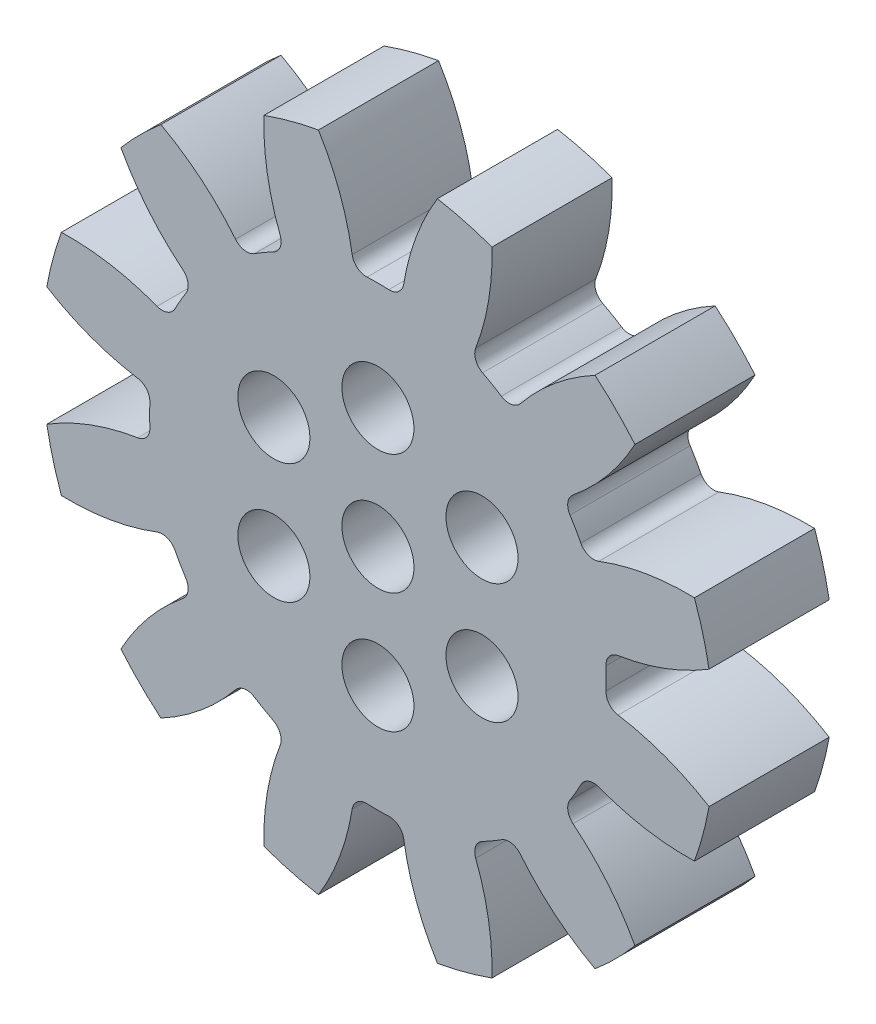
from build123d import *

# Parameters (mm, degrees)
SKETCH1_R                = 14
BOSS_EXTRUDE1_DEPTH      = 2.5
CUT_EXTRUDE1_DEPTH       = 20.956202043
FILLET1_R                = 0.6
FILLET2_R                = 0.6
CIRPATTERN2_COUNT        = 12
FILLET1_OF_CIRPATTERN2_R = 0.6
FILLET2_OF_CIRPATTERN2_R = 0.6
CUT_EXTRUDE2_DEPTH       = 21.118127499
CUT_EXTRUDE2_DEPTH_BACK  = 21.118127499
SKETCH4_R                = 1.5


with BuildPart() as part:
    # Sketch1 → Boss-Extrude1 (new, symmetric)
    with BuildSketch(Plane.XY):
        Circle(SKETCH1_R)
    extrude(amount=BOSS_EXTRUDE1_DEPTH, both=True)

    # Sketch2 → Cut-Extrude1 (cut, symmetric)
    with BuildSketch(Plane.XY):
        with BuildLine():
            ThreePointArc((-3.314591405, 14.951229823), (-1.751535203, 12.36983933), (-0.999747632, 9.447248524))
            ThreePointArc((-0.999747632, 9.447248524), (0, 9.5), (0.999747632, 9.447248524))
            ThreePointArc((0.999747632, 9.447248524), (1.751535203, 12.36983933), (3.314591405, 14.951229823))
            ThreePointArc((3.314591405, 14.951229823), (0, 15.314234862), (-3.314591405, 14.951229823))
        make_face()
    cut_extrude1 = extrude(amount=CUT_EXTRUDE1_DEPTH, both=True, mode=Mode.SUBTRACT)

    # Fillet1
    fillet1_edges = [part.edges().sort_by_distance(p)[0] for p in [
        (-0.999747632, 9.447248524, 0),
    ]]
    fillet(fillet1_edges, radius=FILLET1_R)

    # Fillet2
    fillet2_edges = [part.edges().sort_by_distance(p)[0] for p in [
        (0.999747632, 9.447248524, 0),
    ]]
    fillet(fillet2_edges, radius=FILLET2_R)

    # CirPattern2: Cut-Extrude1 ×12 about axis
    cirpattern2_axis = Axis((0, 0, 2.5), (0, 0, 1))
    for i in range(1, CIRPATTERN2_COUNT):
        add(cut_extrude1.rotate(cirpattern2_axis, i * 360 / CIRPATTERN2_COUNT), mode=Mode.SUBTRACT)

    # Fillet1 of CirPattern2
    fillet1_of_cirpattern2_edges = [part.edges().sort_by_distance(p)[0] for p in [
        (-5.589431109, 7.681683401, 0),
        (-8.681431034, 3.857817415, 0),
        (-9.447248524, -0.999747632, 0),
        (-7.681683401, -5.589431109, 0),
        (-3.857817415, -8.681431034, 0),
        (0.999747632, -9.447248524, 0),
        (5.589431109, -7.681683401, 0),
        (8.681431034, -3.857817415, 0),
        (9.447248524, 0.999747632, 0),
        (7.681683401, 5.589431109, 0),
        (3.857817415, 8.681431034, 0),
    ]]
    fillet(fillet1_of_cirpattern2_edges, radius=FILLET1_OF_CIRPATTERN2_R)

    # Fillet2 of CirPattern2
    fillet2_of_cirpattern2_edges = [part.edges().sort_by_distance(p)[0] for p in [
        (-3.857817415, 8.681431034, 0),
        (-7.681683401, 5.589431109, 0),
        (-9.447248524, 0.999747632, 0),
        (-8.681431034, -3.857817415, 0),
        (-5.589431109, -7.681683401, 0),
        (-0.999747632, -9.447248524, 0),
        (3.857817415, -8.681431034, 0),
        (7.681683401, -5.589431109, 0),
        (9.447248524, -0.999747632, 0),
        (8.681431034, 3.857817415, 0),
        (5.589431109, 7.681683401, 0),
    ]]
    fillet(fillet2_of_cirpattern2_edges, radius=FILLET2_OF_CIRPATTERN2_R)

    # Sketch4 → Cut-Extrude2 (cut, two sides: drawn at the far end of the back side and taken through both)
    with BuildSketch(Plane.XY.offset(2.5).offset(-CUT_EXTRUDE2_DEPTH_BACK)):
        Circle(SKETCH4_R)
        with Locations((0, 5)):
            Circle(SKETCH4_R)
        with Locations((4.330127019, 2.5)):
            Circle(SKETCH4_R)
        with Locations((4.330127019, -2.5)):
            Circle(SKETCH4_R)
        with Locations((0, -5)):
            Circle(SKETCH4_R)
        with Locations((-4.330127019, -2.5)):
            Circle(SKETCH4_R)
        with Locations((-4.330127019, 2.5)):
            Circle(SKETCH4_R)
    extrude(amount=CUT_EXTRUDE2_DEPTH + CUT_EXTRUDE2_DEPTH_BACK, mode=Mode.SUBTRACT)


solid = part.part
